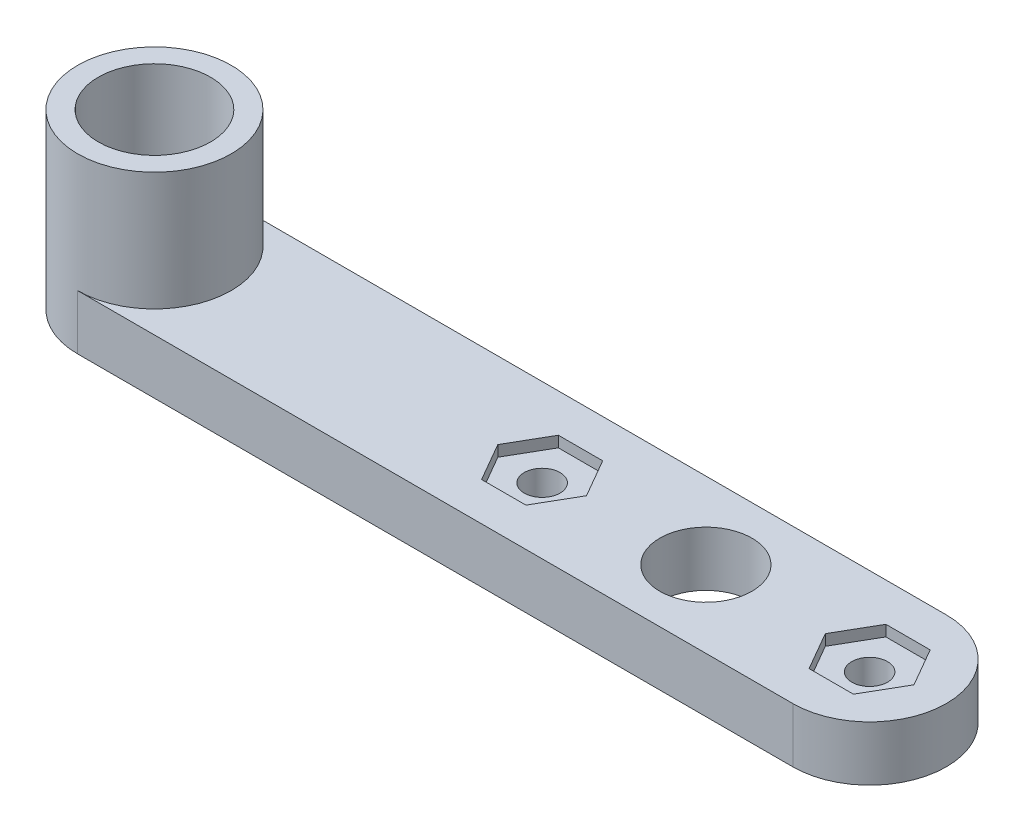
from build123d import *

# Parameters (mm, degrees)
SKETCH1_R           = 6.5024
SKETCH1_R_2         = 2.0701
SKETCH1_R_3         = 5.334
BOSS_EXTRUDE1_DEPTH = 6.35
CUT_EXTRUDE1_DEPTH  = 1.27
SKETCH3_R           = 8.89
SKETCH3_R_2         = 6.5024
BOSS_EXTRUDE2_DEPTH = 13.716


with BuildPart() as part:
    # Sketch1 → Boss-Extrude1 (new body)
    with BuildSketch(Plane(origin=(0, 0, 0), x_dir=(1, 0, 0), z_dir=(0, 1, 0))):
        with BuildLine():
            Line((0, 8.89), (82.8167, 8.89))
            ThreePointArc((82.8167, 8.89), (91.7067, 0), (82.8167, -8.89))
            Line((82.8167, -8.89), (0, -8.89))
            ThreePointArc((0, -8.89), (-8.89, 0), (0, 8.89))
        make_face()
        Circle(SKETCH1_R, mode=Mode.SUBTRACT)
        with Locations((82.8167, 0)):
            Circle(SKETCH1_R_2, mode=Mode.SUBTRACT)
        with Locations((44.8945, 0)):
            Circle(SKETCH1_R_2, mode=Mode.SUBTRACT)
        with Locations((63.8556, 0)):
            Circle(SKETCH1_R_3, mode=Mode.SUBTRACT)
    extrude(amount=BOSS_EXTRUDE1_DEPTH)

    # Sketch2 → Cut-Extrude1 (cut)
    with BuildSketch(Plane(origin=(0, 6.35, 0), x_dir=(1, 0, 0), z_dir=(0, 1, 0))):
        Polygon((50.027143893, 0), (47.460821947, 4.445), (42.328178053, 4.445), (39.761856107, 0), (42.328178053, -4.445), (47.460821947, -4.445), align=None)
        Polygon((77.684056107, 0), (80.250378053, -4.445), (85.383021947, -4.445), (87.949343893, 0), (85.383021947, 4.445), (80.250378053, 4.445), align=None)
    extrude(amount=-CUT_EXTRUDE1_DEPTH, mode=Mode.SUBTRACT)

    # Sketch3 → Boss-Extrude2 (add)
    with BuildSketch(Plane(origin=(0, 6.35, 0), x_dir=(1, 0, 0), z_dir=(0, 1, 0))):
        Circle(SKETCH3_R)
        Circle(SKETCH3_R_2, mode=Mode.SUBTRACT)
    extrude(amount=BOSS_EXTRUDE2_DEPTH)


solid = part.part
